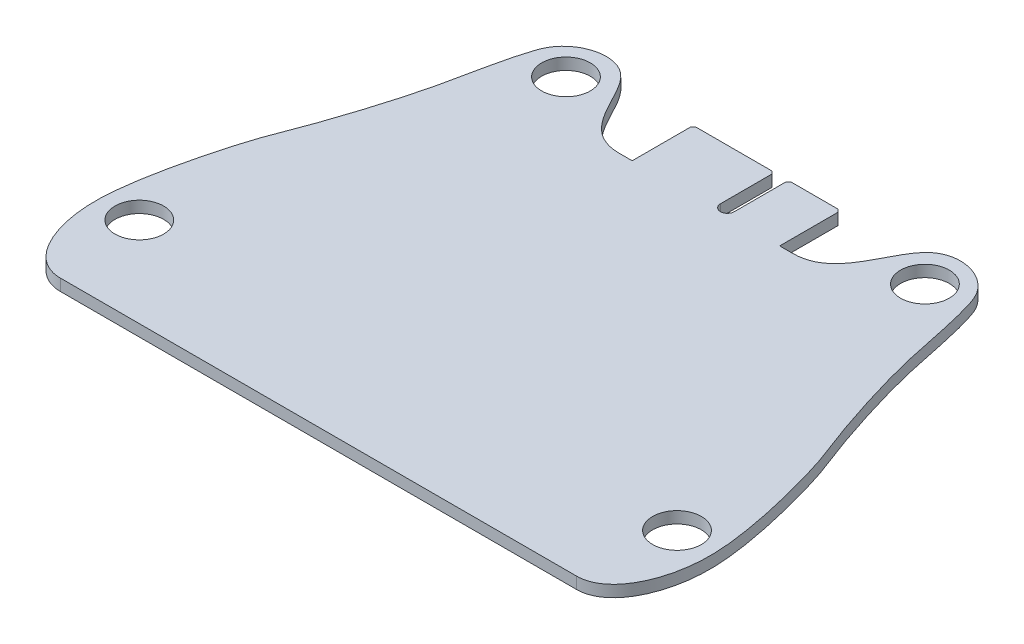
from build123d import *

# Parameters (mm, degrees)
BOSS_EXTRUDE1_DEPTH      = 0.8
BOSS_EXTRUDE1_DEPTH_BACK = 0.8
SKETCH1_R                = 3.35


with BuildPart() as part:
    # Sketch1 → Boss-Extrude1 (new, two sides: drawn at the far end of the back side and taken through both)
    with BuildSketch(Plane(origin=(-28.757656934, 0, -23.069119009), x_dir=(1, 0, 0), z_dir=(0, 1, 0)).offset(-BOSS_EXTRUDE1_DEPTH_BACK)):
        with BuildLine():
            add(Edge.make_bspline(
                [(16.817483134, 5.190880991), (10.987472329, 5.190880991), (9.904581863, 18.143996448), (-0.009496302, 15.469838802), (-2.525585513, 7.788768106), (-3.505431187, 0.19553058), (-7.723605652, -12.668162815), (-10.292716368, -18.849058937), (-13.549930091, -30.902689566), (-13.575667282, -42.489894913), (-10.61652949, -48.139119009), (-6.763242532, -48.139119009)],
                knots=[0, 0, 0, 0, 0.162529727, 0.293884615, 0.32593632, 0.483046776, 0.646953909, 0.682356014, 0.819877627, 0.853361046, 1, 1, 1, 1], degree=3))
            Line((-6.763242532, -48.139119009), (64.278556399, -48.139119009))
            add(Edge.make_bspline(
                [(40.697830733, 5.190880991), (46.527841538, 5.190880991), (47.610732005, 18.143996448), (57.524810169, 15.469838802), (60.04089938, 7.788768106), (61.020745054, 0.19553058), (65.23891952, -12.668162815), (67.808030235, -18.849058937), (71.065243959, -30.902689566), (71.090981149, -42.489894913), (68.131843357, -48.139119009), (64.278556399, -48.139119009)],
                knots=[0, 0, 0, 0, 0.162529727, 0.293884615, 0.32593632, 0.483046776, 0.646953909, 0.682356014, 0.819877627, 0.853361046, 1, 1, 1, 1], degree=3))
            Line((40.697830733, 5.190880991), (38.907656934, 5.190880991))
            Line((38.907656934, 5.190880991), (38.907656934, 13.2373276))
            Line((38.907656934, 13.2373276), (38.554103543, 13.590880991))
            Line((38.554103543, 13.590880991), (32.061210324, 13.590880991))
            Line((32.061210324, 13.590880991), (31.707656934, 13.2373276))
            Line((31.707656934, 13.2373276), (31.707656934, 6.131715151))
            ThreePointArc((31.707656934, 6.131715151), (30.757656934, 5.190880991), (29.807656934, 6.131715151))
            Line((29.807656934, 6.131715151), (29.807656934, 13.2373276))
            Line((29.807656934, 13.2373276), (29.454103543, 13.590880991))
            Line((29.454103543, 13.590880991), (18.961210324, 13.590880991))
            Line((18.961210324, 13.590880991), (18.607656934, 13.2373276))
            Line((18.607656934, 13.2373276), (18.607656934, 5.190880991))
            Line((18.607656934, 5.190880991), (16.817483134, 5.190880991))
        make_face()
        with Locations((-8.242343066, -35.789119009)):
            Circle(SKETCH1_R, mode=Mode.SUBTRACT)
        with Locations((65.757656934, -35.789119009)):
            Circle(SKETCH1_R, mode=Mode.SUBTRACT)
        with Locations((4.057656934, 10.630880991)):
            Circle(SKETCH1_R, mode=Mode.SUBTRACT)
        with Locations((53.457656934, 10.630880991)):
            Circle(SKETCH1_R, mode=Mode.SUBTRACT)
    extrude(amount=BOSS_EXTRUDE1_DEPTH + BOSS_EXTRUDE1_DEPTH_BACK)


solid = part.part
